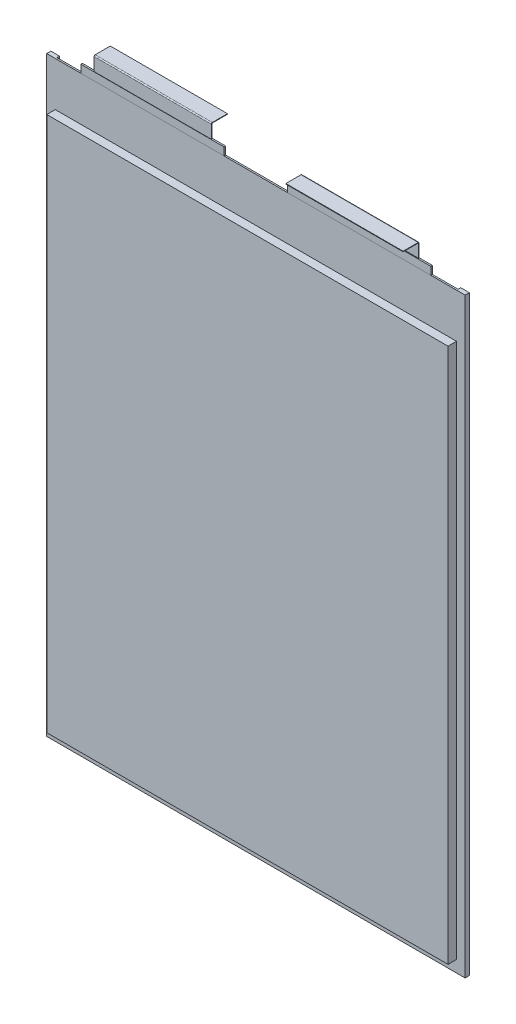
from build123d import *

# Parameters (mm, degrees)
INSULATION_DEPTH      = 0.3
INSULATION_DEPTH_BACK = 0.3
SKETCH1_W             = 160.6
SKETCH1_H             = 227
MAIN_BODY_DEPTH       = 3.55
MAIN_BODY_DEPTH_BACK  = 3.55
SKETCH2_W             = 154
SKETCH2_H             = 205.5
SIDE_FOLDS_DEPTH      = 1.016
SKETCH114_W           = 55
SKETCH114_H           = 0.6
BOSS_EXTRUDE1_DEPTH   = 3
BOSS_EXTRUDE1_2_DEPTH = 3
BASE_FLANGE1_DEPTH    = 45
BASE_FLANGE2_DEPTH    = 45


# Sheet-metal steps are written as plain solids
with BuildPart() as part:
    # Sketch1 → Insulation (new, two sides: drawn at the far end of the back side and taken through both)
    with BuildSketch(Plane.XY.offset(-INSULATION_DEPTH_BACK)):
        Rectangle(SKETCH1_W, SKETCH1_H)
    extrude(amount=INSULATION_DEPTH + INSULATION_DEPTH_BACK)

    # Sketch2 → Main Body (add, two sides: drawn at the far end of the back side and taken through both)
    with BuildSketch(Plane.XY.offset(-MAIN_BODY_DEPTH_BACK)):
        with Locations((0, -6.25)):
            Rectangle(SKETCH2_W, SKETCH2_H)
    extrude(amount=MAIN_BODY_DEPTH + MAIN_BODY_DEPTH_BACK)

    # Sketch5 → Side Folds (add)
    with BuildSketch(Plane(origin=(0, 0, -0.3), x_dir=(-1, 0, 0), z_dir=(0, 0, -1))):
        Polygon((-77, -109), (-77, 96.5), (-77, 113.5), (-80.3, 113.5), (-80.3, -113.5), (-77, -113.5), align=None)
        Polygon((77, 113.5), (77, 96.5), (77, -109), (77, -113.5), (80.3, -113.5), (80.3, 113.5), align=None)
    extrude(amount=SIDE_FOLDS_DEPTH)


with BuildPart() as body_2:
    # Sketch114 → Boss-Extrude1 (new body)
    with BuildSketch(Plane(origin=(0, 113.5, 0), x_dir=(1, 0, 0), z_dir=(0, 1, 0))):
        with Locations((-39.7, 0)):
            Rectangle(SKETCH114_W, SKETCH114_H)
    extrude(amount=BOSS_EXTRUDE1_DEPTH)


with BuildPart() as body_3:
    # Sketch114 → Boss-Extrude1 2 (new body)
    with BuildSketch(Plane(origin=(0, 113.5, 0), x_dir=(1, 0, 0), z_dir=(0, 1, 0))):
        with Locations((39.7, 0)):
            Rectangle(SKETCH114_W, SKETCH114_H)
    extrude(amount=BOSS_EXTRUDE1_2_DEPTH)


with BuildPart() as body_4:
    # Sketch115 → Base-Flange1 (new body)
    with BuildSketch(Plane.ZY.offset(62.2)):
        with BuildLine():
            Line((0, 116.5), (0, 121.5))
            ThreePointArc((0, 121.5), (-0.058578644, 121.641421356), (-0.2, 121.7))
            Line((-0.2, 121.7), (-6, 121.7))
            Line((-6, 121.7), (-6, 121.9))
            Line((-6, 121.9), (-0.2, 121.9))
            ThreePointArc((-0.2, 121.9), (0.082842712, 121.782842712), (0.2, 121.5))
            Line((0.2, 121.5), (0.2, 116.5))
            Line((0.2, 116.5), (0, 116.5))
        make_face()
    extrude(amount=-BASE_FLANGE1_DEPTH)


with BuildPart() as body_5:
    # Sketch120 → Base-Flange2 (new body)
    with BuildSketch(Plane(origin=(62.2, 0, 0), x_dir=(0, 0, -1), z_dir=(1, 0, 0))):
        with BuildLine():
            Line((0, 116.5), (0, 121.5))
            ThreePointArc((0, 121.5), (-0.058578644, 121.641421356), (-0.2, 121.7))
            Line((-0.2, 121.7), (-6, 121.7))
            Line((-6, 121.7), (-6, 121.9))
            Line((-6, 121.9), (-0.2, 121.9))
            ThreePointArc((-0.2, 121.9), (0.082842712, 121.782842712), (0.2, 121.5))
            Line((0.2, 121.5), (0.2, 116.5))
            Line((0.2, 116.5), (0, 116.5))
        make_face()
    extrude(amount=-BASE_FLANGE2_DEPTH)


solid = Compound([part.part, body_2.part, body_3.part, body_4.part, body_5.part])
